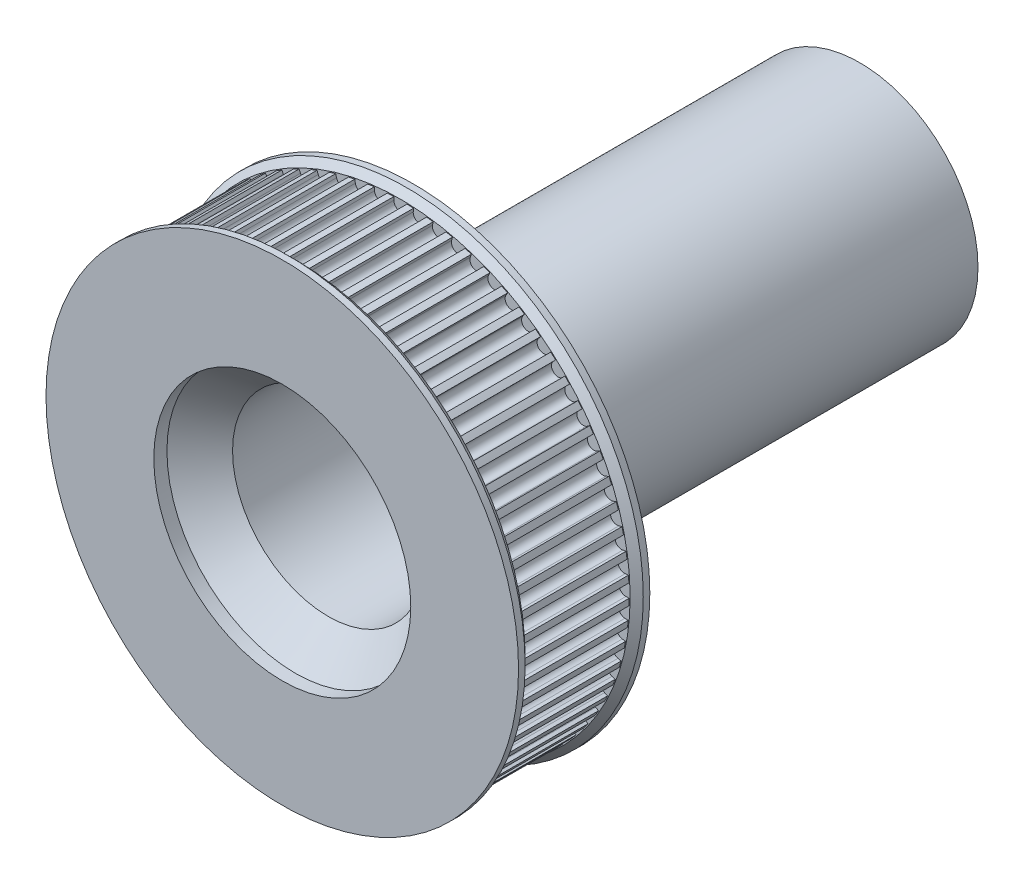
from build123d import *

# Parameters (mm, degrees)
SKETCH1_R           = 18
BOSS_EXTRUDE1_DEPTH = 86
SKETCH2_R           = 14.576002813
CUT_EXTRUDE1_DEPTH  = 60
SKETCH3_R           = 4.364419647
CUT_EXTRUDE2_DEPTH  = 60
SKETCH4_R           = 34.85
SKETCH4_R_2         = 14.576002813
BOSS_EXTRUDE2_DEPTH = 18
CUT_EXTRUDE3_START  = -13
SKETCH5_R           = 3.181436575
CUT_EXTRUDE3_DEPTH  = 4
CHAMFER2_SIZE       = 5
CHAMFER3_SIZE       = 5
CUT_EXTRUDE4_DEPTH  = 18
CIRPATTERN1_COUNT   = 73
SKETCH7_R           = 36
SKETCH7_R_2         = 19.576002813
BOSS_EXTRUDE3_DEPTH = 2
LPATTERN1_COUNT     = 2
LPATTERN1_PITCH     = 18
CHAMFER4_SIZE       = 1


with BuildPart() as part:
    # Sketch1 → Boss-Extrude1 (new body)
    with BuildSketch(Plane.XY):
        Circle(SKETCH1_R)
    extrude(amount=BOSS_EXTRUDE1_DEPTH)

    # Sketch2 → Cut-Extrude1 (cut)
    with BuildSketch(Plane.XY.offset(86)):
        Circle(SKETCH2_R)
    extrude(amount=-CUT_EXTRUDE1_DEPTH, mode=Mode.SUBTRACT)

    # Sketch3 → Cut-Extrude2 (cut)
    with BuildSketch(Plane(origin=(0, 0, 0), x_dir=(-1, 0, 0), z_dir=(0, 0, -1))):
        Circle(SKETCH3_R)
    extrude(amount=-CUT_EXTRUDE2_DEPTH, mode=Mode.SUBTRACT)

    # Sketch4 → Boss-Extrude2 (add)
    with BuildSketch(Plane.XY.offset(86)):
        Circle(SKETCH4_R)
        Circle(SKETCH4_R_2, mode=Mode.SUBTRACT)
    extrude(amount=-BOSS_EXTRUDE2_DEPTH)

    # Sketch5 → Cut-Extrude3 (cut)
    with BuildSketch(Plane.XY.offset(86).offset(CUT_EXTRUDE3_START)):
        with Locations((1.618994911, -28.119385301)):
            Circle(SKETCH5_R)
    extrude(amount=-CUT_EXTRUDE3_DEPTH, mode=Mode.SUBTRACT)

    # Chamfer2
    chamfer2_edges = [part.edges().sort_by_distance(p)[0] for p in [
        (-14.576002813, 0, 26),
    ]]
    chamfer(chamfer2_edges, length=CHAMFER2_SIZE)

    # Chamfer3
    chamfer3_edges = [part.edges().sort_by_distance(p)[0] for p in [
        (-14.576002813, 0, 86),
    ]]
    chamfer(chamfer3_edges, length=CHAMFER3_SIZE)

    # Sketch6 → Cut-Extrude4 (cut)
    with BuildSketch(Plane.XY.offset(86)):
        with BuildLine():
            Line((1, 35.669255209), (1, 34.337502479))
            ThreePointArc((1, 34.337502479), (0, 33.337502479), (-1, 34.337502479))
            Line((-1, 34.337502479), (-1, 35.669255209))
            ThreePointArc((-1, 35.669255209), (0, 36.669255209), (1, 35.669255209))
        make_face()
    cut_extrude4 = extrude(amount=-CUT_EXTRUDE4_DEPTH, mode=Mode.SUBTRACT)

    # CirPattern1: Cut-Extrude4 ×73 about axis
    cirpattern1_axis = Axis((0, 0, 86), (0, 0, 1))
    for i in range(1, CIRPATTERN1_COUNT):
        add(cut_extrude4.rotate(cirpattern1_axis, i * 360 / CIRPATTERN1_COUNT), mode=Mode.SUBTRACT)

    # Sketch7 → Boss-Extrude3 (add)
    with BuildSketch(Plane.XY.offset(86)):
        Circle(SKETCH7_R)
        Circle(SKETCH7_R_2, mode=Mode.SUBTRACT)
    boss_extrude3 = extrude(amount=BOSS_EXTRUDE3_DEPTH)

    # LPattern1: Boss-Extrude3 ×2
    with Locations(*[(0, 0, -i * LPATTERN1_PITCH) for i in range(1, LPATTERN1_COUNT)]):
        add(boss_extrude3)

    # Chamfer4
    chamfer4_edges = [part.edges().sort_by_distance(p)[0] for p in [
        (-36, 0, 86),
        (-36, 0, 70),
    ]]
    chamfer(chamfer4_edges, length=CHAMFER4_SIZE)


solid = part.part
